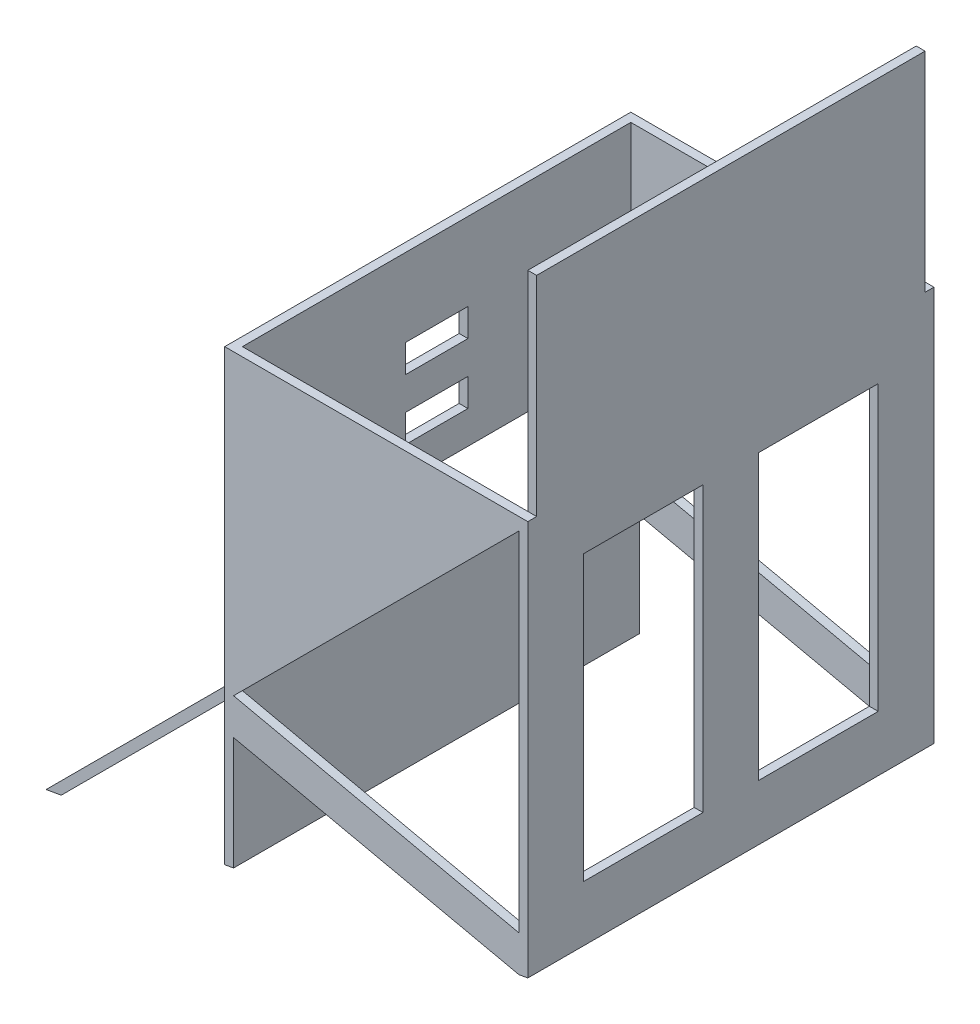
from build123d import *

# Parameters (mm, degrees)
BOSS_EXTRUDE1_REACH             = 673.67
SKETCH1_W                       = 217.7
SKETCH1_H                       = 291.7
SKETCH1_W_2                     = 205
SKETCH1_H_2                     = 279
BOSS_EXTRUDE4_REACH             = 372.103
BOSS_EXTRUDE4_DIRECTION_2_REACH = 372.103
SKETCH8_W                       = 6.35
SKETCH8_H                       = 279
BOSS_EXTRUDE5_DEPTH             = 150
CUT_EXTRUDE1_REACH              = 449.542
CUT_EXTRUDE1_DIRECTION_2_REACH  = 449.542
SKETCH6_W                       = 6.35
SKETCH6_H                       = 20
CUT_EXTRUDE2_DEPTH              = 22.5
CUT_EXTRUDE3_DEPTH              = 448.541672907
CUT_EXTRUDE3_DEPTH_BACK         = 448.541672907
CUT_EXTRUDE4_REACH              = 516.931
SKETCH10_W                      = 85.85
SKETCH10_H                      = 203.880323673


with BuildPart() as part:
    # Boss-Extrude1: up to this plane
    boss_extrude1_end = Plane(origin=(51.828623609, -293.934730807, 0), z_dir=(-0.17364817766693072, 0.984807753012208, 0))
    # Sketch1 → Boss-Extrude1 (new, up to the surface)
    with BuildSketch(Plane(origin=(0, 0, 0), x_dir=(1, 0, 0), z_dir=(0, 1, 0)), mode=Mode.PRIVATE) as boss_extrude1_sk1:
        Rectangle(SKETCH1_W, SKETCH1_H)
        Rectangle(SKETCH1_W_2, SKETCH1_H_2, mode=Mode.SUBTRACT)
    boss_extrude1_tool1 = split(extrude(boss_extrude1_sk1.sketch, amount=-BOSS_EXTRUDE1_REACH, mode=Mode.PRIVATE), bisect_by=boss_extrude1_end, keep=Keep.BOTH, mode=Mode.PRIVATE)
    add(boss_extrude1_tool1.solids().sort_by_distance((0, 0, -142.21019))[0])

    # Boss-Extrude4: up to this face of the body (flat: up to its plane)
    boss_extrude4_end = Plane(part.part.faces().sort_by_distance((-2.037498325, -151.716390725, -139.5))[0])
    # Sketch7 → Boss-Extrude4 (add, up to the picked face)
    with BuildSketch(Plane.XY, mode=Mode.PRIVATE) as boss_extrude4_sk1:
        Polygon((102.5, 0), (-243.511090961, -346.011090961), (-232.608395461, -344.088651582), (102.5, -8.980256121), align=None)
    boss_extrude4_tool1 = split(extrude(boss_extrude4_sk1.sketch, amount=-BOSS_EXTRUDE4_REACH, mode=Mode.PRIVATE), bisect_by=boss_extrude4_end, keep=Keep.BOTH, mode=Mode.PRIVATE)
    add(boss_extrude4_tool1.solids().sort_by(Axis((-67.794415, -174.760585, 0), (0, 0, -1)))[0])

    # Boss-Extrude4 direction 2: up to this face of the body (flat: up to its plane)
    boss_extrude4_direction_2_end = Plane(part.part.faces().sort_by_distance((-2.037498325, -151.716390725, 139.5))[0])
    # Sketch7 → Boss-Extrude4 direction 2 (add, up to the picked face)
    with BuildSketch(Plane.XY, mode=Mode.PRIVATE) as boss_extrude4_direction_2_sk1:
        Polygon((102.5, 0), (-243.511090961, -346.011090961), (-232.608395461, -344.088651582), (102.5, -8.980256121), align=None)
    boss_extrude4_direction_2_tool1 = split(extrude(boss_extrude4_direction_2_sk1.sketch, amount=BOSS_EXTRUDE4_DIRECTION_2_REACH, mode=Mode.PRIVATE), bisect_by=boss_extrude4_direction_2_end, keep=Keep.BOTH, mode=Mode.PRIVATE)
    add(boss_extrude4_direction_2_tool1.solids().sort_by(Axis((-67.794415, -174.760585, 0), (0, 0, 1)))[0])

    # Sketch8 → Boss-Extrude5 (add)
    with BuildSketch(Plane(origin=(0, 0, 0), x_dir=(1, 0, 0), z_dir=(0, 1, 0))):
        with Locations((105.675, 0)):
            Rectangle(SKETCH8_W, SKETCH8_H)
    extrude(amount=BOSS_EXTRUDE5_DEPTH)

    # Cut-Extrude1: up to this face of the body (flat: up to its plane)
    cut_extrude1_end = Plane(part.part.faces().sort_by_distance((-34.166666667, -68.333333333, -139.5))[0])
    # Sketch4 → Cut-Extrude1 (cut, up to the picked face)
    with BuildSketch(Plane.XY, mode=Mode.PRIVATE) as cut_extrude1_sk1:
        Polygon((-108.85, -211.35), (-102.5, -205), (-102.5, -143), (-108.85, -143), align=None)
    cut_extrude1_tool1 = split(extrude(cut_extrude1_sk1.sketch, amount=-CUT_EXTRUDE1_REACH, mode=Mode.PRIVATE), bisect_by=cut_extrude1_end, keep=Keep.BOTH, mode=Mode.PRIVATE)
    add(cut_extrude1_tool1.solids().sort_by(Axis((-105.726557, -175.613278, 0), (0, 0, -1)))[0], mode=Mode.SUBTRACT)

    # Cut-Extrude1 direction 2: up to this face of the body (flat: up to its plane)
    cut_extrude1_direction_2_end = Plane(part.part.faces().sort_by_distance((-34.166666667, -68.333333333, 139.5))[0])
    # Sketch4 → Cut-Extrude1 direction 2 (cut, up to the picked face)
    with BuildSketch(Plane.XY, mode=Mode.PRIVATE) as cut_extrude1_direction_2_sk1:
        Polygon((-108.85, -211.35), (-102.5, -205), (-102.5, -143), (-108.85, -143), align=None)
    cut_extrude1_direction_2_tool1 = split(extrude(cut_extrude1_direction_2_sk1.sketch, amount=CUT_EXTRUDE1_DIRECTION_2_REACH, mode=Mode.PRIVATE), bisect_by=cut_extrude1_direction_2_end, keep=Keep.BOTH, mode=Mode.PRIVATE)
    add(cut_extrude1_direction_2_tool1.solids().sort_by(Axis((-105.726557, -175.613278, 0), (0, 0, 1)))[0], mode=Mode.SUBTRACT)

    # Sketch6 → Cut-Extrude2 (cut, symmetric)
    with BuildSketch(Plane.XY):
        with Locations((-105.675, -109.5)):
            Rectangle(SKETCH6_W, SKETCH6_H)
        with Locations((-105.675, -66)):
            Rectangle(SKETCH6_W, SKETCH6_H)
    extrude(amount=CUT_EXTRUDE2_DEPTH, both=True, mode=Mode.SUBTRACT)

    # Sketch9 → Cut-Extrude3 (cut, two sides: drawn at the far end of the back side and taken through both)
    with BuildSketch(Plane.XY.offset(-CUT_EXTRUDE3_DEPTH_BACK)):
        Polygon((-102.5, -321.147031045), (-102.5, -239.985401715), (102.5, -285), align=None)
        Polygon((-102.5, -213.980256121), (102.5, -8.980256121), (102.5, -258.994854407), align=None)
    extrude(amount=CUT_EXTRUDE3_DEPTH + CUT_EXTRUDE3_DEPTH_BACK, mode=Mode.SUBTRACT)

    # Sketch10 → Cut-Extrude4 (cut, up to next)
    with BuildSketch(Plane(origin=(108.85, 0, 0), x_dir=(0, 0, -1), z_dir=(1, 0, 0)), mode=Mode.PRIVATE) as cut_extrude4_sk1:
        with Locations((-62.925, -141.940161837)):
            Rectangle(SKETCH10_W, SKETCH10_H)
    cut_extrude4_tool1 = extrude(cut_extrude4_sk1.sketch, amount=-CUT_EXTRUDE4_REACH, mode=Mode.PRIVATE) & part.part
    # Sketch10 → Cut-Extrude4 (cut, up to next)
    with BuildSketch(Plane(origin=(108.85, 0, 0), x_dir=(0, 0, -1), z_dir=(1, 0, 0)), mode=Mode.PRIVATE) as cut_extrude4_sk2:
        with Locations((62.925, -141.940161837)):
            Rectangle(SKETCH10_W, SKETCH10_H)
    cut_extrude4_tool2 = extrude(cut_extrude4_sk2.sketch, amount=-CUT_EXTRUDE4_REACH, mode=Mode.PRIVATE) & part.part
    add(cut_extrude4_tool1.solids().sort_by_distance((108.85, -141.940162, 62.925))[0], mode=Mode.SUBTRACT)
    add(cut_extrude4_tool2.solids().sort_by_distance((108.85, -141.940162, -62.925))[0], mode=Mode.SUBTRACT)


solid = part.part
